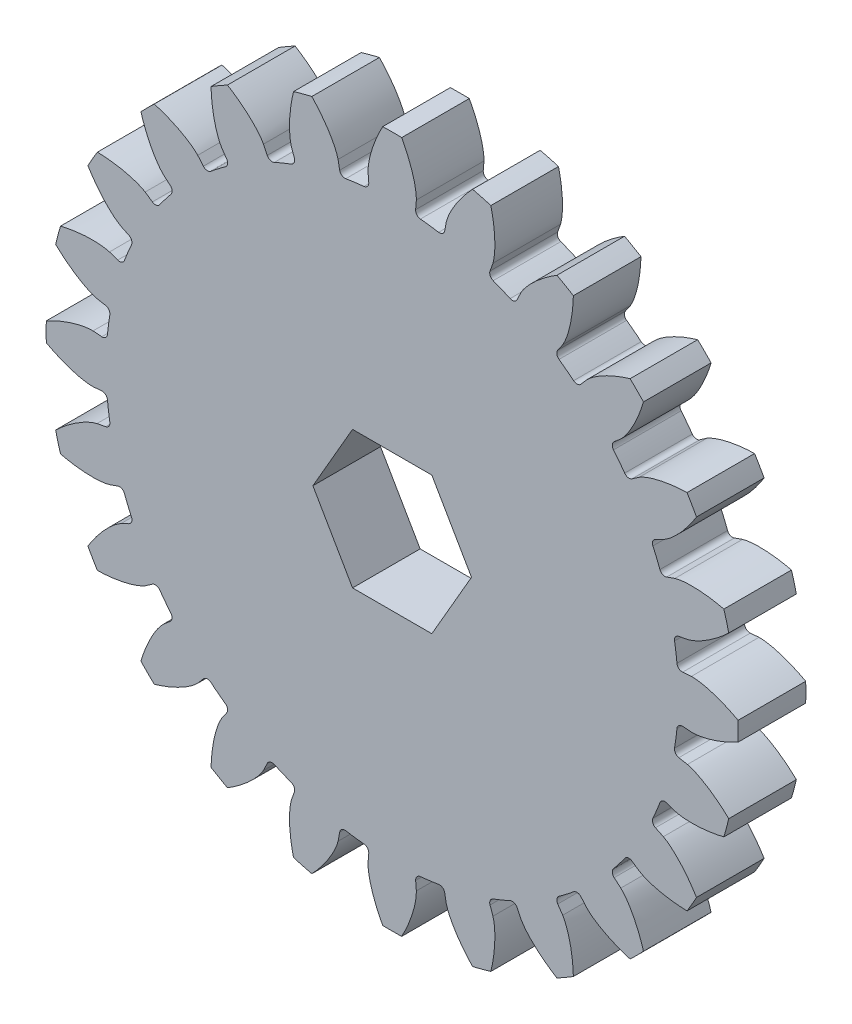
from build123d import *

# Parameters (mm, degrees)
BOSS_EXTRUDE1_DEPTH = 3.175
CIRPATTERN1_COUNT   = 24
SKETCH3_R           = 15
BOSS_EXTRUDE2_DEPTH = 3.175
CUT_EXTRUDE1_DEPTH  = 47.398518449


with BuildPart() as part:
    # Sketch2 → Boss-Extrude1 (new, symmetric)
    with BuildSketch(Plane.XY):
        with BuildLine():
            Line((0, 0), (0, 32.5))
            ThreePointArc((0, 32.5), (0.445239812, 32.496950034), (0.890396057, 32.487800708))
            add(Edge.make_bspline(
                [(2.268267326, 28.099376554), (2.274390268, 28.346971537), (2.217157939, 28.902773604), (1.882150488, 30.414937455), (1.355060129, 31.616685743), (0.890396057, 32.487800708)],
                knots=[0, 0, 0, 0, 0.160017259, 0.360014664, 1, 1, 1, 1], degree=3))
            Line((2.268267326, 28.099376554), (2.202261265, 27.281691119))
            ThreePointArc((2.202261265, 27.281691119), (2.316842906, 26.920992534), (2.65131337, 26.743899536))
            ThreePointArc((2.65131337, 26.743899536), (3.079998733, 26.697925627), (3.507891416, 26.645080649))
            Line((3.507891416, 26.645080649), (0, 0))
        make_face()
    boss_extrude1 = extrude(amount=BOSS_EXTRUDE1_DEPTH, both=True)

    # Mirror1: Boss-Extrude1 across plane
    add(boss_extrude1.mirror(Plane(origin=(0, 0, 3.175), x_dir=(0, 0, 1), z_dir=(1, 0, 0))))


with BuildPart() as cirpattern1_1:
    # CirPattern1: pattern copy
    add(part.part.rotate(Axis((0, 0, 3.175), (0, 0, -1)), 1 * 360 / CIRPATTERN1_COUNT))


with BuildPart() as cirpattern1_2:
    # CirPattern1: pattern copy
    add(part.part.rotate(Axis((0, 0, 3.175), (0, 0, -1)), 2 * 360 / CIRPATTERN1_COUNT))


with BuildPart() as cirpattern1_3:
    # CirPattern1: pattern copy
    add(part.part.rotate(Axis((0, 0, 3.175), (0, 0, -1)), 3 * 360 / CIRPATTERN1_COUNT))


with BuildPart() as cirpattern1_4:
    # CirPattern1: pattern copy
    add(part.part.rotate(Axis((0, 0, 3.175), (0, 0, -1)), 4 * 360 / CIRPATTERN1_COUNT))


with BuildPart() as cirpattern1_5:
    # CirPattern1: pattern copy
    add(part.part.rotate(Axis((0, 0, 3.175), (0, 0, -1)), 5 * 360 / CIRPATTERN1_COUNT))


with BuildPart() as cirpattern1_6:
    # CirPattern1: pattern copy
    add(part.part.rotate(Axis((0, 0, 3.175), (0, 0, -1)), 6 * 360 / CIRPATTERN1_COUNT))


with BuildPart() as cirpattern1_7:
    # CirPattern1: pattern copy
    add(part.part.rotate(Axis((0, 0, 3.175), (0, 0, -1)), 7 * 360 / CIRPATTERN1_COUNT))


with BuildPart() as cirpattern1_8:
    # CirPattern1: pattern copy
    add(part.part.rotate(Axis((0, 0, 3.175), (0, 0, -1)), 8 * 360 / CIRPATTERN1_COUNT))


with BuildPart() as cirpattern1_9:
    # CirPattern1: pattern copy
    add(part.part.rotate(Axis((0, 0, 3.175), (0, 0, -1)), 9 * 360 / CIRPATTERN1_COUNT))


with BuildPart() as cirpattern1_10:
    # CirPattern1: pattern copy
    add(part.part.rotate(Axis((0, 0, 3.175), (0, 0, -1)), 10 * 360 / CIRPATTERN1_COUNT))


with BuildPart() as cirpattern1_11:
    # CirPattern1: pattern copy
    add(part.part.rotate(Axis((0, 0, 3.175), (0, 0, -1)), 11 * 360 / CIRPATTERN1_COUNT))


with BuildPart() as cirpattern1_12:
    # CirPattern1: pattern copy
    add(part.part.rotate(Axis((0, 0, 3.175), (0, 0, -1)), 12 * 360 / CIRPATTERN1_COUNT))


with BuildPart() as cirpattern1_13:
    # CirPattern1: pattern copy
    add(part.part.rotate(Axis((0, 0, 3.175), (0, 0, -1)), 13 * 360 / CIRPATTERN1_COUNT))


with BuildPart() as cirpattern1_14:
    # CirPattern1: pattern copy
    add(part.part.rotate(Axis((0, 0, 3.175), (0, 0, -1)), 14 * 360 / CIRPATTERN1_COUNT))


with BuildPart() as cirpattern1_15:
    # CirPattern1: pattern copy
    add(part.part.rotate(Axis((0, 0, 3.175), (0, 0, -1)), 15 * 360 / CIRPATTERN1_COUNT))


with BuildPart() as cirpattern1_16:
    # CirPattern1: pattern copy
    add(part.part.rotate(Axis((0, 0, 3.175), (0, 0, -1)), 16 * 360 / CIRPATTERN1_COUNT))


with BuildPart() as cirpattern1_17:
    # CirPattern1: pattern copy
    add(part.part.rotate(Axis((0, 0, 3.175), (0, 0, -1)), 17 * 360 / CIRPATTERN1_COUNT))


with BuildPart() as cirpattern1_18:
    # CirPattern1: pattern copy
    add(part.part.rotate(Axis((0, 0, 3.175), (0, 0, -1)), 18 * 360 / CIRPATTERN1_COUNT))


with BuildPart() as cirpattern1_19:
    # CirPattern1: pattern copy
    add(part.part.rotate(Axis((0, 0, 3.175), (0, 0, -1)), 19 * 360 / CIRPATTERN1_COUNT))


with BuildPart() as cirpattern1_20:
    # CirPattern1: pattern copy
    add(part.part.rotate(Axis((0, 0, 3.175), (0, 0, -1)), 20 * 360 / CIRPATTERN1_COUNT))


with BuildPart() as cirpattern1_21:
    # CirPattern1: pattern copy
    add(part.part.rotate(Axis((0, 0, 3.175), (0, 0, -1)), 21 * 360 / CIRPATTERN1_COUNT))


with BuildPart() as cirpattern1_22:
    # CirPattern1: pattern copy
    add(part.part.rotate(Axis((0, 0, 3.175), (0, 0, -1)), 22 * 360 / CIRPATTERN1_COUNT))


with BuildPart() as cirpattern1_23:
    # CirPattern1: pattern copy
    add(part.part.rotate(Axis((0, 0, 3.175), (0, 0, -1)), 23 * 360 / CIRPATTERN1_COUNT))


with BuildPart() as part_1:
    add(part.part)

    add(cirpattern1_1.part)  # Boss-Extrude2 merges CirPattern1_1

    add(cirpattern1_2.part)  # Boss-Extrude2 merges CirPattern1_2

    add(cirpattern1_3.part)  # Boss-Extrude2 merges CirPattern1_3

    add(cirpattern1_4.part)  # Boss-Extrude2 merges CirPattern1_4

    add(cirpattern1_5.part)  # Boss-Extrude2 merges CirPattern1_5

    add(cirpattern1_6.part)  # Boss-Extrude2 merges CirPattern1_6

    add(cirpattern1_7.part)  # Boss-Extrude2 merges CirPattern1_7

    add(cirpattern1_8.part)  # Boss-Extrude2 merges CirPattern1_8

    add(cirpattern1_9.part)  # Boss-Extrude2 merges CirPattern1_9

    add(cirpattern1_10.part)  # Boss-Extrude2 merges CirPattern1_10

    add(cirpattern1_11.part)  # Boss-Extrude2 merges CirPattern1_11

    add(cirpattern1_12.part)  # Boss-Extrude2 merges CirPattern1_12

    add(cirpattern1_13.part)  # Boss-Extrude2 merges CirPattern1_13

    add(cirpattern1_14.part)  # Boss-Extrude2 merges CirPattern1_14

    add(cirpattern1_15.part)  # Boss-Extrude2 merges CirPattern1_15

    add(cirpattern1_16.part)  # Boss-Extrude2 merges CirPattern1_16

    add(cirpattern1_17.part)  # Boss-Extrude2 merges CirPattern1_17

    add(cirpattern1_18.part)  # Boss-Extrude2 merges CirPattern1_18

    add(cirpattern1_19.part)  # Boss-Extrude2 merges CirPattern1_19

    add(cirpattern1_20.part)  # Boss-Extrude2 merges CirPattern1_20

    add(cirpattern1_21.part)  # Boss-Extrude2 merges CirPattern1_21

    add(cirpattern1_22.part)  # Boss-Extrude2 merges CirPattern1_22

    add(cirpattern1_23.part)  # Boss-Extrude2 merges CirPattern1_23
    # Sketch3 → Boss-Extrude2 (add, through all)
    with BuildSketch(Plane.XY):
        Circle(SKETCH3_R)
    extrude(amount=BOSS_EXTRUDE2_DEPTH)

    # Sketch4 → Cut-Extrude1 (cut, through all)
    with BuildSketch(Plane.XY.offset(3.175)):
        Polygon((7.447818473, 0), (3.723909236, 6.45), (-3.723909236, 6.45), (-7.447818473, 0), (-3.723909236, -6.45), (3.723909236, -6.45), align=None)
    extrude(amount=-CUT_EXTRUDE1_DEPTH, mode=Mode.SUBTRACT)


solid = part_1.part
